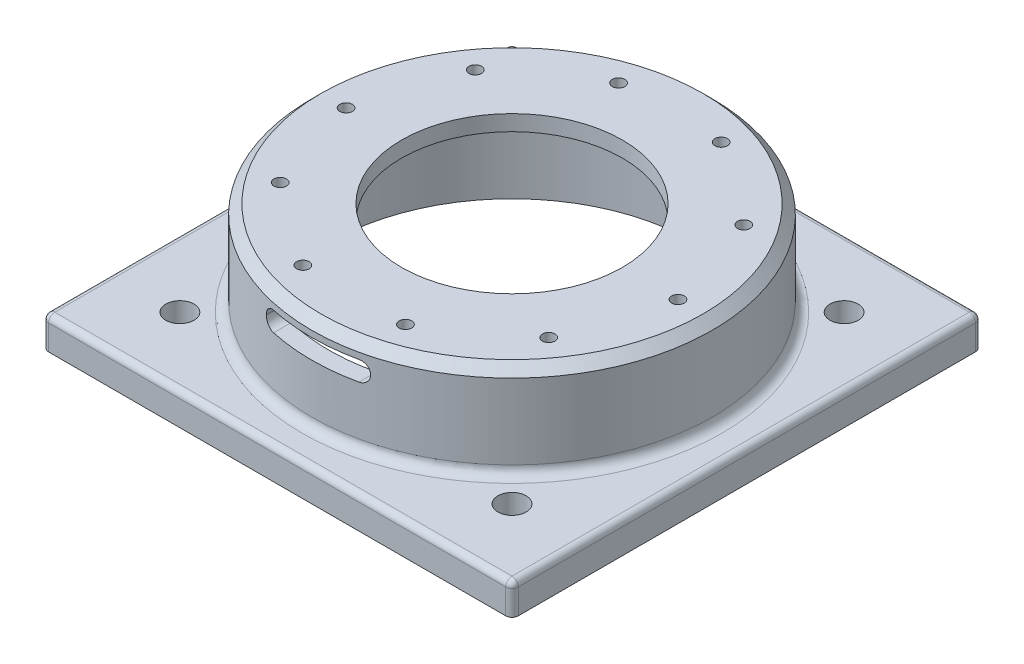
from build123d import *

# Parameters (mm, degrees)
SKETCH_1_W          = 150
SKETCH_1_H          = 150
SKETCH_1_R          = 4.5
EXTRUDE_1_DEPTH     = 10
FILLET_1_R          = 2
FILLET_2_R          = 2
SKETCH_4_R          = 64
EXTRUDE_4_DEPTH     = 30
FILLET_5_R          = 3
SKETCH_11_R         = 35.25
CUT_EXTRUDE_2_DEPTH = 114.357840488
SKETCH_10_R         = 58.5
CUT_EXTRUDE_3_DEPTH = 35
SKETCH_12_R         = 2
CUT_EXTRUDE_4_DEPTH = 114.357840488
CHAMFER_2_SIZE      = 3
SKETCH_14_W         = 33.25
SKETCH_14_H         = 6.25
CUT_EXTRUDE_5_DEPTH = 9
FILLET_7_R          = 3


with BuildPart() as part:
    # Эскиз1 → Бобышка-Вытянуть1 (new body)
    with BuildSketch(Plane(origin=(0, 0, 0), x_dir=(1, 0, 0), z_dir=(0, 1, 0))):
        Rectangle(SKETCH_1_W, SKETCH_1_H)
        with Locations((53.033008589, 53.033008589)):
            Circle(SKETCH_1_R, mode=Mode.SUBTRACT)
        with Locations((53.033008589, -53.033008589)):
            Circle(SKETCH_1_R, mode=Mode.SUBTRACT)
        with Locations((-53.033008589, -53.033008589)):
            Circle(SKETCH_1_R, mode=Mode.SUBTRACT)
        with Locations((-53.033008589, 53.033008589)):
            Circle(SKETCH_1_R, mode=Mode.SUBTRACT)
    extrude(amount=EXTRUDE_1_DEPTH)

    # Скругление1
    fillet_1_edges = [part.edges().sort_by_distance(p)[0] for p in [
        (-75, 5, -75),
        (75, 5, -75),
        (-75, 5, 75),
        (75, 5, 75),
    ]]
    fillet(fillet_1_edges, radius=FILLET_1_R)

    # Скругление2
    fillet_2_edges = [part.edges().sort_by_distance(p)[0] for p in [
        (-74.414213562, 10, -74.414213562),
        (74.414213562, 10, -74.414213562),
        (74.414213562, 10, 74.414213562),
        (-74.414213562, 10, 74.414213562),
        (0, 10, 75),
        (75, 10, 0),
        (0, 10, -75),
        (-75, 10, 0),
    ]]
    fillet(fillet_2_edges, radius=FILLET_2_R)

    # Эскиз4 → Бобышка-Вытянуть4 (add)
    with BuildSketch(Plane(origin=(0, 10, 0), x_dir=(1, 0, 0), z_dir=(0, 1, 0))):
        Circle(SKETCH_4_R)
    extrude(amount=EXTRUDE_4_DEPTH)

    # Скругление5
    fillet_5_edges = [part.edges().sort_by_distance(p)[0] for p in [
        (-64, 10, 0),
    ]]
    fillet(fillet_5_edges, radius=FILLET_5_R)

    # Эскиз11 → Вырез-Вытянуть2 (cut, through all)
    with BuildSketch(Plane(origin=(0, 40, 0), x_dir=(1, 0, 0), z_dir=(0, 1, 0))):
        Circle(SKETCH_11_R)
    extrude(amount=-CUT_EXTRUDE_2_DEPTH, mode=Mode.SUBTRACT)

    # Эскиз10 → Вырез-Вытянуть3 (cut)
    with BuildSketch(Plane.XZ):
        Circle(SKETCH_10_R)
    extrude(amount=-CUT_EXTRUDE_3_DEPTH, mode=Mode.SUBTRACT)

    # Эскиз12 → Вырез-Вытянуть4 (cut, through all)
    with BuildSketch(Plane(origin=(0, 40, 0), x_dir=(1, 0, 0), z_dir=(0, 1, 0))):
        with Locations((-53, 0)):
            Circle(SKETCH_12_R)
        with Locations((-42.877900702, 31.152618372)):
            Circle(SKETCH_12_R)
        with Locations((-16.377900702, 50.405995364)):
            Circle(SKETCH_12_R)
        with Locations((16.377900702, 50.405995364)):
            Circle(SKETCH_12_R)
        with Locations((42.877900702, 31.152618372)):
            Circle(SKETCH_12_R)
        with Locations((53, 0)):
            Circle(SKETCH_12_R)
        with Locations((42.877900702, -31.152618372)):
            Circle(SKETCH_12_R)
        with Locations((16.377900702, -50.405995364)):
            Circle(SKETCH_12_R)
        with Locations((-16.377900702, -50.405995364)):
            Circle(SKETCH_12_R)
        with Locations((-42.877900702, -31.152618372)):
            Circle(SKETCH_12_R)
    extrude(amount=-CUT_EXTRUDE_4_DEPTH, mode=Mode.SUBTRACT)

    # Фаска2
    chamfer_2_edges = [part.edges().sort_by_distance(p)[0] for p in [
        (-64, 40, 0),
    ]]
    chamfer(chamfer_2_edges, length=CHAMFER_2_SIZE)

    # Эскиз14 → Вырез-Вытянуть5 (cut)
    with BuildSketch(Plane.XY.offset(64)):
        with Locations((0, 31.875)):
            Rectangle(SKETCH_14_W, SKETCH_14_H)
    extrude(amount=-CUT_EXTRUDE_5_DEPTH, mode=Mode.SUBTRACT)

    # Скругление7
    fillet_7_edges = [part.edges().sort_by_distance(p)[0] for p in [
        (-16.625, 35, 58.945474725),
        (-16.625, 28.75, 58.945474725),
        (16.625, 35, 58.945474725),
        (16.625, 28.75, 58.945474725),
    ]]
    fillet(fillet_7_edges, radius=FILLET_7_R)


solid = part.part
